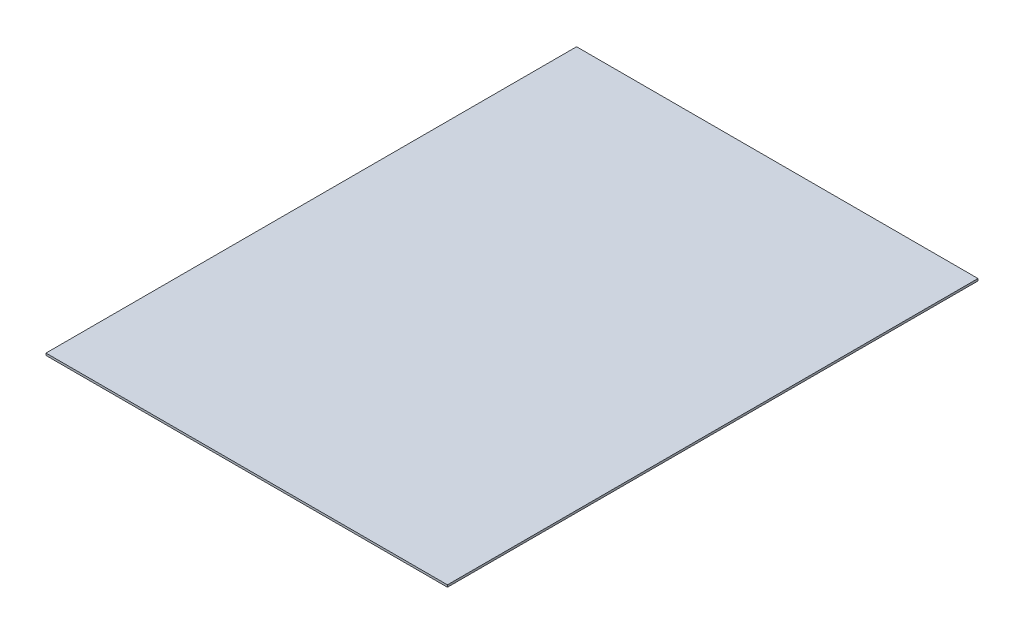
from build123d import *

# Parameters (mm, degrees)
SKETCH3_W           = 245
SKETCH3_H           = 323.8
BOSS_EXTRUDE1_DEPTH = 1.2954


with BuildPart() as part:
    # Sketch3 → Boss-Extrude1 (new body)
    with BuildSketch(Plane(origin=(0, 0, 0), x_dir=(1, 0, 0), z_dir=(0, 1, 0))):
        Rectangle(SKETCH3_W, SKETCH3_H)
    extrude(amount=BOSS_EXTRUDE1_DEPTH)


solid = part.part
